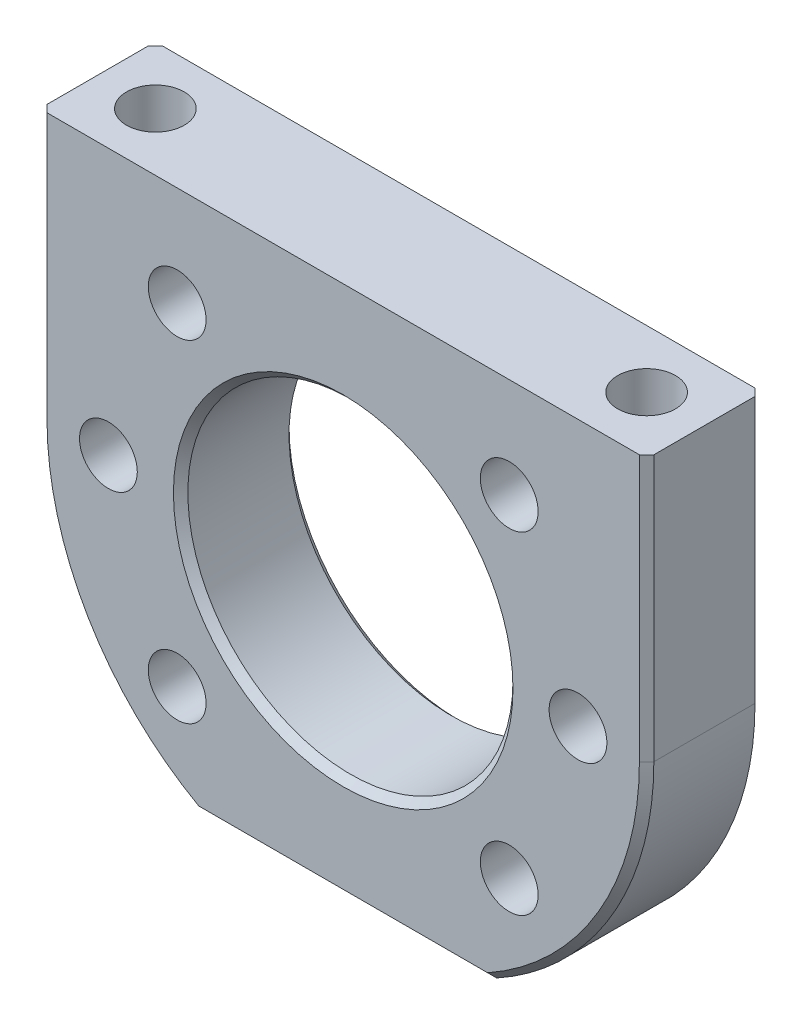
from build123d import *

# Parameters (mm, degrees)
BOSS_EXTRUDE1_DEPTH = 4
SKETCH2_R           = 11.25
CUT_EXTRUDE1_DEPTH  = 30.044104393
SKETCH3_R           = 2
CUT_EXTRUDE2_DEPTH  = 8
SKETCH6_R           = 2
CUT_EXTRUDE3_DEPTH  = 8
CHAMFER1_SIZE       = 0.5


with BuildPart() as part:
    # Sketch1 → Boss-Extrude1 (new, symmetric)
    with BuildSketch(Plane.XY):
        with BuildLine():
            Line((21, 0), (21, 18.4))
            Line((21, 18.4), (-21, 18.4))
            Line((-21, 18.4), (-21, 0))
            ThreePointArc((-21, 0), (-18.076871405, -10.687690125), (-10.121264743, -18.4))
            Line((-10.121264743, -18.4), (10.121264743, -18.4))
            ThreePointArc((10.121264743, -18.4), (18.076871405, -10.687690125), (21, 0))
        make_face()
    extrude(amount=BOSS_EXTRUDE1_DEPTH, both=True)

    # Sketch2 → Cut-Extrude1 (cut, through all)
    with BuildSketch(Plane.XY.offset(4)):
        Circle(SKETCH2_R)
    extrude(amount=-CUT_EXTRUDE1_DEPTH, mode=Mode.SUBTRACT)

    # Sketch3 → Cut-Extrude2 (cut)
    with BuildSketch(Plane.XY.offset(4)):
        with Locations((-16.25, 0)):
            Circle(SKETCH3_R)
        with Locations((16.25, 0)):
            Circle(SKETCH3_R)
        with Locations((-11.490485194, 11.490485194)):
            Circle(SKETCH3_R)
        with Locations((11.490485194, 11.490485194)):
            Circle(SKETCH3_R)
        with Locations((11.490485194, -11.490485194)):
            Circle(SKETCH3_R)
        with Locations((-11.490485194, -11.490485194)):
            Circle(SKETCH3_R)
    extrude(amount=-CUT_EXTRUDE2_DEPTH, mode=Mode.SUBTRACT)

    # Sketch6 → Cut-Extrude3 (cut)
    with BuildSketch(Plane(origin=(-3.375, 18.4, 0), x_dir=(0, 0, -1), z_dir=(0, -1, 0))):
        with Locations((0, -13.625)):
            Circle(SKETCH6_R)
        with Locations((0, 20.375)):
            Circle(SKETCH6_R)
    extrude(amount=CUT_EXTRUDE3_DEPTH, mode=Mode.SUBTRACT)

    # Chamfer1
    chamfer1_edges = [part.edges().sort_by_distance(p)[0] for p in [
        (-11.25, 0, -4),
        (-21, 9.2, 4),
        (-18.076871405, -10.687690125, 4),
        (0, -18.4, 4),
        (18.076871405, -10.687690125, 4),
        (21, 9.2, 4),
        (-21, 9.2, -4),
        (-18.076871405, -10.687690125, -4),
        (0, -18.4, -4),
        (18.076871405, -10.687690125, -4),
        (21, 9.2, -4),
        (-11.25, 0, 4),
    ]]
    chamfer(chamfer1_edges, length=CHAMFER1_SIZE)


solid = part.part
